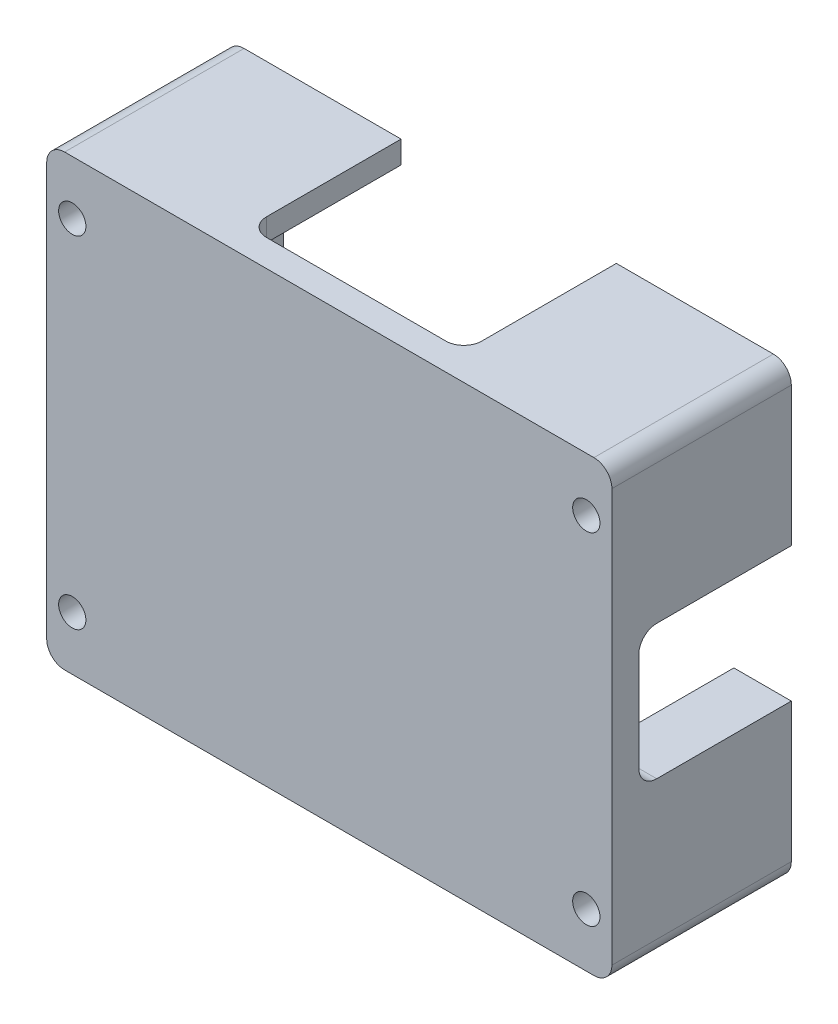
from build123d import *

# Parameters (mm, degrees)
SKETCH1_W             = 80.01
SKETCH1_H             = 63.5
BOSS_EXTRUDE1_DEPTH   = 25.4
SKETCH2_W             = 63.754
SKETCH2_H             = 57.15
CUT_EXTRUDE1_DEPTH    = 22.86
F_8_CLEARANCE_HOLE1_D = 3.8608
SKETCH13_W            = 20.32
SKETCH13_H            = 21.59
CUT_EXTRUDE3_DEPTH    = 50.8
SKETCH14_W            = 8.128
SKETCH14_H            = 19.05
CUT_EXTRUDE4_DEPTH    = 21.59
SKETCH15_W            = 30.48
SKETCH15_H            = 3.175
CUT_EXTRUDE5_DEPTH    = 21.59
FILLET1_R             = 2.54
FILLET2_R             = 2.54
FILLET3_R             = 2.54


with BuildPart() as part:
    # Sketch1 → Boss-Extrude1 (new body)
    with BuildSketch(Plane.XY):
        Rectangle(SKETCH1_W, SKETCH1_H)
    extrude(amount=BOSS_EXTRUDE1_DEPTH)

    # Sketch2 → Cut-Extrude1 (cut)
    with BuildSketch(Plane.XY):
        Rectangle(SKETCH2_W, SKETCH2_H)
    extrude(amount=CUT_EXTRUDE1_DEPTH, mode=Mode.SUBTRACT)

    # #8 Clearance Hole1 (through all)
    with Locations(Plane(origin=(0, 0, 0), x_dir=(-1, 0, 0), z_dir=(0, 0, -1))):
        with Locations((-36.3855, -24.13), (-36.3855, 24.13), (36.3855, 24.13), (36.3855, -24.13)):
            Hole(F_8_CLEARANCE_HOLE1_D / 2)

    # Sketch13 → Cut-Extrude3 (cut)
    with BuildSketch(Plane(origin=(0, 0, 0), x_dir=(1, 0, 0), z_dir=(0, 1, 0))):
        with Locations((0, -10.795)):
            Rectangle(SKETCH13_W, SKETCH13_H)
    extrude(amount=-CUT_EXTRUDE3_DEPTH, mode=Mode.SUBTRACT)

    # Sketch14 → Cut-Extrude4 (cut)
    with BuildSketch(Plane(origin=(0, 0, 0), x_dir=(-1, 0, 0), z_dir=(0, 0, -1))):
        with Locations((-35.941, 0)):
            Rectangle(SKETCH14_W, SKETCH14_H)
        with Locations((35.941, 0)):
            Rectangle(SKETCH14_W, SKETCH14_H)
    extrude(amount=-CUT_EXTRUDE4_DEPTH, mode=Mode.SUBTRACT)

    # Sketch15 → Cut-Extrude5 (cut)
    with BuildSketch(Plane(origin=(0, 0, 0), x_dir=(-1, 0, 0), z_dir=(0, 0, -1))):
        with Locations((0, 30.1625)):
            Rectangle(SKETCH15_W, SKETCH15_H)
        with Locations((0, -30.1625)):
            Rectangle(SKETCH15_W, SKETCH15_H)
    extrude(amount=-CUT_EXTRUDE5_DEPTH, mode=Mode.SUBTRACT)

    # Fillet1
    # the kernel refuses this fillet: 2.54 mm, written as the material it adds along each edge
    with BuildSketch(Plane(origin=(31.877, -28.575, 22.86), x_dir=(0, 0, -1), z_dir=(0, 1, 0))) as fillet1_piece_1_section:
        with BuildLine():
            CenterArc((FILLET1_R, FILLET1_R), FILLET1_R, 180, 90)
            Line((0, FILLET1_R), (0, 0))
            Line((0, 0), (FILLET1_R, 0))
        make_face()
    fillet1_piece_1 = extrude(amount=63.5, mode=Mode.PRIVATE)
    fillet1_piece_1 = split(fillet1_piece_1, bisect_by=Plane(origin=(31.776201135, -9.525, 21.276910424), z_dir=(0, -1, 0)), keep=Keep.TOP, mode=Mode.PRIVATE)
    add(fillet1_piece_1)
    with BuildSketch(Plane(origin=(31.877, -34.925, 22.86), x_dir=(0, 0, -1), z_dir=(0, 1, 0))) as fillet1_piece_2_section:
        with BuildLine():
            CenterArc((FILLET1_R, FILLET1_R), FILLET1_R, 180, 90)
            Line((0, FILLET1_R), (0, 0))
            Line((0, 0), (FILLET1_R, 0))
        make_face()
    fillet1_piece_2 = extrude(amount=63.5, mode=Mode.PRIVATE)
    fillet1_piece_2 = split(fillet1_piece_2, bisect_by=Plane(origin=(31.257176883, 0, 21.59), z_dir=(0, 0, 1)), keep=Keep.TOP, mode=Mode.PRIVATE)
    fillet1_piece_2 = split(fillet1_piece_2, bisect_by=Plane(origin=(31.257176883, -9.525, 22.406874338), z_dir=(0, 1, 0)), keep=Keep.TOP, mode=Mode.PRIVATE)
    add(fillet1_piece_2)
    with BuildSketch(Plane(origin=(31.877, -34.925, 22.86), x_dir=(0, 0, -1), z_dir=(0, 1, 0))) as fillet1_piece_3_section:
        with BuildLine():
            CenterArc((FILLET1_R, FILLET1_R), FILLET1_R, 180, 90)
            Line((0, FILLET1_R), (0, 0))
            Line((0, 0), (FILLET1_R, 0))
        make_face()
    fillet1_piece_3 = extrude(amount=63.5, mode=Mode.PRIVATE)
    fillet1_piece_3 = split(fillet1_piece_3, bisect_by=Plane(origin=(31.776201135, 9.525, 21.276910424), z_dir=(0, 1, 0)), keep=Keep.TOP, mode=Mode.PRIVATE)
    add(fillet1_piece_3)
    with BuildSketch(Plane(origin=(-31.877, 28.575, 22.86), x_dir=(1, 0, 0), z_dir=(0, -1, 0))) as fillet1_piece_4_section:
        with BuildLine():
            CenterArc((FILLET1_R, -FILLET1_R), FILLET1_R, 90, 90)
            Line((0, -FILLET1_R), (0, 0))
            Line((0, 0), (FILLET1_R, 0))
        make_face()
    fillet1_piece_4 = extrude(amount=57.15, mode=Mode.PRIVATE)
    fillet1_piece_4 = split(fillet1_piece_4, bisect_by=Plane(origin=(-31.257176883, 19.05, 21.59), z_dir=(0, 0, 1)), keep=Keep.TOP, mode=Mode.PRIVATE)
    add(fillet1_piece_4)
    with BuildSketch(Plane(origin=(-31.877, 28.575, 22.86), x_dir=(1, 0, 0), z_dir=(0, -1, 0))) as fillet1_piece_5_section:
        with BuildLine():
            CenterArc((FILLET1_R, -FILLET1_R), FILLET1_R, 90, 90)
            Line((0, -FILLET1_R), (0, 0))
            Line((0, 0), (FILLET1_R, 0))
        make_face()
    fillet1_piece_5 = extrude(amount=63.5, mode=Mode.PRIVATE)
    fillet1_piece_5 = split(fillet1_piece_5, bisect_by=Plane(origin=(-31.776201135, 9.525, 21.276910424), z_dir=(0, 1, 0)), keep=Keep.TOP, mode=Mode.PRIVATE)
    add(fillet1_piece_5)
    with BuildSketch(Plane(origin=(-31.877, 34.925, 22.86), x_dir=(1, 0, 0), z_dir=(0, -1, 0))) as fillet1_piece_6_section:
        with BuildLine():
            CenterArc((FILLET1_R, -FILLET1_R), FILLET1_R, 90, 90)
            Line((0, -FILLET1_R), (0, 0))
            Line((0, 0), (FILLET1_R, 0))
        make_face()
    fillet1_piece_6 = extrude(amount=63.5, mode=Mode.PRIVATE)
    fillet1_piece_6 = split(fillet1_piece_6, bisect_by=Plane(origin=(-31.776201135, -9.525, 21.276910424), z_dir=(0, -1, 0)), keep=Keep.TOP, mode=Mode.PRIVATE)
    add(fillet1_piece_6)

    # Fillet2
    fillet2_edges = [part.edges().sort_by_distance(p)[0] for p in [
        (-15.24, 30.1625, 21.59),
        (15.24, 30.1625, 21.59),
        (15.24, -30.1625, 21.59),
        (-15.24, -30.1625, 21.59),
        (-35.770852263, 9.525, 21.59),
        (-35.770852263, -9.525, 21.59),
        (35.770852263, -9.525, 21.59),
        (35.770852263, 9.525, 21.59),
    ]]
    fillet(fillet2_edges, radius=FILLET2_R)

    # Fillet3
    fillet3_edges = [part.edges().sort_by_distance(p)[0] for p in [
        (-40.005, 31.75, 12.7),
        (40.005, 31.75, 12.7),
        (40.005, -31.75, 12.7),
        (-40.005, -31.75, 12.7),
    ]]
    fillet(fillet3_edges, radius=FILLET3_R)


solid = part.part
